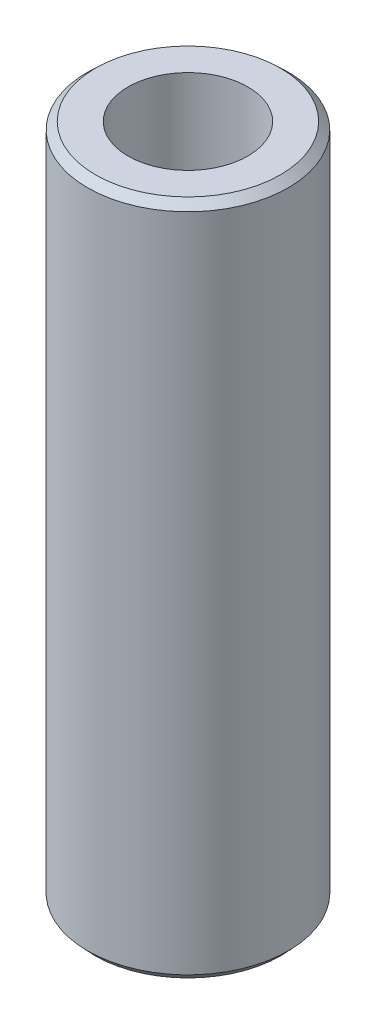
from build123d import *
from OCP.BRepFilletAPI import BRepFilletAPI_MakeChamfer

# Parameters (mm, degrees)
SKETCH1_R           = 27.5
BOSS_EXTRUDE1_DEPTH = 185.360989208
SKETCH2_R           = 16.433469022
CUT_EXTRUDE1_DEPTH  = 190.396927959
CHAMFER1_SIZE       = 2.005989846
CHAMFER1_SIZE2      = 2.153333929


with BuildPart() as part:
    # Sketch1 → Boss-Extrude1 (new body)
    with BuildSketch(Plane(origin=(0, 0, 0), x_dir=(1, 0, 0), z_dir=(0, 1, 0))):
        Circle(SKETCH1_R)
    extrude(amount=BOSS_EXTRUDE1_DEPTH)

    # Sketch2 → Cut-Extrude1 (cut, through all)
    with BuildSketch(Plane(origin=(0, 0, 0), x_dir=(1, 0, 0), z_dir=(0, 1, 0))):
        Circle(SKETCH2_R)
    extrude(amount=CUT_EXTRUDE1_DEPTH, mode=Mode.SUBTRACT)

    # Chamfer1: one chamfer whose edges measure the first distance from different faces: ONE call of the kernel's chamfer builder (chamfer() names one face for all edges)
    chamfer1_edges_1 = [part.edges().sort_by_distance(p)[0] for p in [
        (-27.5, 185.360989208, 0),
    ]]
    chamfer1_side_1 = [part.faces().sort_by_distance(p)[0] for p in [
        (-27.5, 92.680494604, 0),
    ]]
    chamfer1_edges_2 = [part.edges().sort_by_distance(p)[0] for p in [
        (-27.5, 0, 0),
    ]]
    chamfer1_side_2 = [part.faces().sort_by_distance(p)[0] for p in [
        (-26.722182541, 0, 0),
    ]]
    chamfer1 = BRepFilletAPI_MakeChamfer(part.part.solid().wrapped)
    for e in chamfer1_edges_1:
        chamfer1.Add(CHAMFER1_SIZE, CHAMFER1_SIZE2, e.wrapped, chamfer1_side_1[0].wrapped)  # the first distance lies on this face
    for e in chamfer1_edges_2:
        chamfer1.Add(CHAMFER1_SIZE, CHAMFER1_SIZE2, e.wrapped, chamfer1_side_2[0].wrapped)  # the first distance lies on this face
    add(Compound.cast(chamfer1.Shape()), mode=Mode.REPLACE)


solid = part.part
